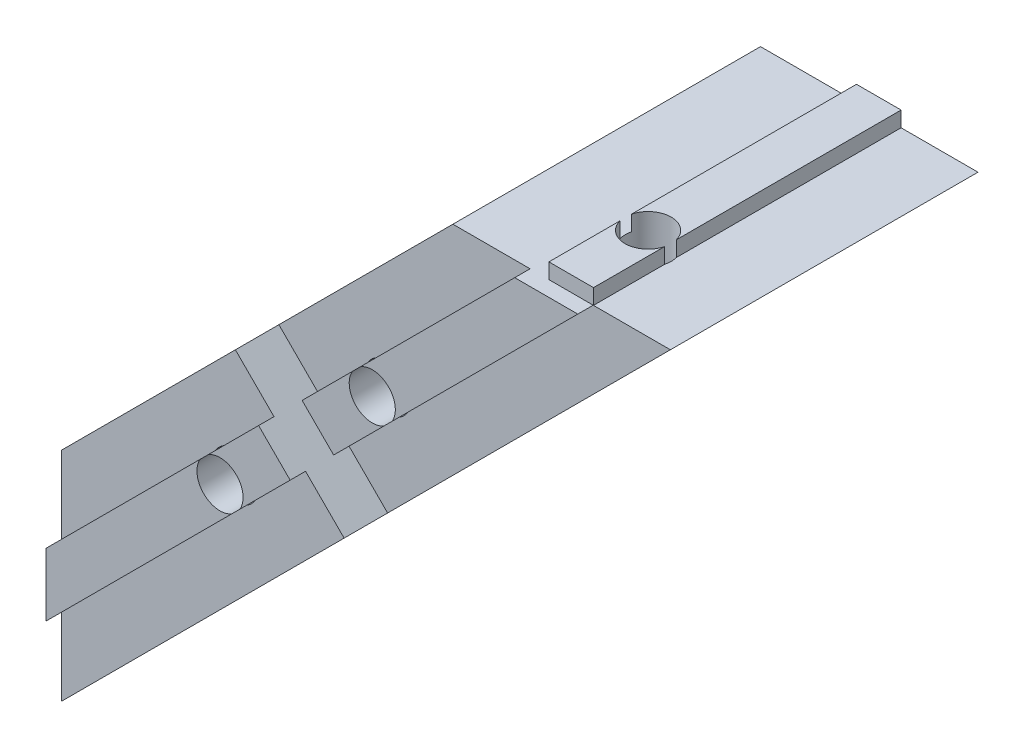
from build123d import *

# Parameters (mm, degrees)
BOSS_EXTRU_1_DEPTH       = 20
ESQUISSE2_W              = 10
ESQUISSE2_H              = 21
ENL_V_MAT_EXTRU_1_DEPTH  = 2.5
ESQUISSE3_R              = 1.5
ENL_V_MAT_EXTRU_2_DEPTH  = 38.732870983
ESQUISSE4_R              = 4.1
ENL_V_MAT_EXTRU_3_DEPTH  = 36.842591175
ESQUISSE5_R              = 1.25
ENL_V_MAT_EXTRU_4_DEPTH  = 37.976343789
BOSS_EXTRU_2_DEPTH       = 1
ENL_V_MAT_EXTRU_7_DEPTH  = 34.271609519
ENL_V_MAT_EXTRU_8_DEPTH  = 34.271609519
ESQUISSE11_R             = 1.5
ENL_V_MAT_EXTRU_9_DEPTH  = 34.271609519
ESQUISSE12_R             = 4.1
ENL_V_MAT_EXTRU_10_DEPTH = 7.5


with BuildPart() as part:
    # Esquisse1 → Boss.-Extru.1 (new body)
    with BuildSketch(Plane.XY):
        Polygon((0, 0), (0, 5), (-1, 5), (-1, 7.9), (0, 7.9), (0, 14.142135624), (11.313708499, 25.455844123), (18.384776311, 18.384776311), align=None)
    extrude(amount=BOSS_EXTRU_1_DEPTH)

    # Esquisse2 → Enlèv. mat.-Extru.1 (cut)
    with BuildSketch(Plane(origin=(0, 0, 0), x_dir=(0, 0, -1), z_dir=(0.7071067811865512, -0.7071067811865438, 0))):
        with Locations((-5, 15.5)):
            Rectangle(ESQUISSE2_W, ESQUISSE2_H)
    extrude(amount=-ENL_V_MAT_EXTRU_1_DEPTH, mode=Mode.SUBTRACT)

    # Esquisse3 → Enlèv. mat.-Extru.2 (cut, through all)
    with BuildSketch(Plane.ZY.offset(1)):
        with Locations((15, 6.45)):
            Circle(ESQUISSE3_R)
    extrude(amount=-ENL_V_MAT_EXTRU_2_DEPTH, mode=Mode.SUBTRACT)

    # Esquisse4 → Enlèv. mat.-Extru.3 (cut, through all)
    with BuildSketch(Plane.ZY.offset(-3)):
        with Locations((15, 6.45)):
            Circle(ESQUISSE4_R)
    extrude(amount=-ENL_V_MAT_EXTRU_3_DEPTH, mode=Mode.SUBTRACT)

    # Esquisse5 → Enlèv. mat.-Extru.4 (cut, through all)
    with BuildSketch(Plane(origin=(-1.767766953, 1.767766953, 0), x_dir=(0, 0, -1), z_dir=(0.7071067811865513, -0.7071067811865438, 0))):
        with Locations((-5, 11.5)):
            Circle(ESQUISSE5_R)
    extrude(amount=-ENL_V_MAT_EXTRU_4_DEPTH, mode=Mode.SUBTRACT)

    # Esquisse6 → Boss.-Extru.2 (add)
    with BuildSketch(Plane.XY.offset(20)):
        Polygon((0, 9.121677477), (13.823937572, 22.94561505), (15.874547238, 20.895005384), (0, 5.020458146), align=None)
    extrude(amount=BOSS_EXTRU_2_DEPTH)

    # Esquisse9 → Enlèv. mat.-Extru.7 (cut, through all)
    with BuildSketch(Plane(origin=(0, 0, 10), x_dir=(-1, 0, 0), z_dir=(0, 0, -1))):
        Polygon((-18.384776311, 18.384776311), (-12.02081528, 12.02081528), (-4.949747468, 19.091883092), (-11.313708499, 25.455844123), align=None)
    extrude(amount=ENL_V_MAT_EXTRU_7_DEPTH, mode=Mode.SUBTRACT)

    # Esquisse10 → Enlèv. mat.-Extru.8 (cut, through all)
    with BuildSketch(Plane(origin=(0, 0, 10), x_dir=(-1, 0, 0), z_dir=(0, 0, -1))):
        Polygon((-11.313708499, 25.455844123), (-4.242640687, 18.384776311), (-11.313708499, 11.313708499), (-18.384776311, 18.384776311), align=None)
    extrude(amount=ENL_V_MAT_EXTRU_8_DEPTH, mode=Mode.SUBTRACT)

    # Esquisse11 → Enlèv. mat.-Extru.9 (cut, through all)
    with BuildSketch(Plane(origin=(0, 0, 10), x_dir=(-1, 0, 0), z_dir=(0, 0, -1))):
        with Locations((-11.313708499, 18.384776311)):
            Circle(ESQUISSE11_R)
    extrude(amount=-ENL_V_MAT_EXTRU_9_DEPTH, mode=Mode.SUBTRACT)

    # Esquisse12 → Enlèv. mat.-Extru.10 (cut)
    with BuildSketch(Plane(origin=(0, 0, 10), x_dir=(-1, 0, 0), z_dir=(0, 0, -1))):
        with Locations((-11.313708499, 18.384776311)):
            Circle(ESQUISSE12_R)
    extrude(amount=-ENL_V_MAT_EXTRU_10_DEPTH, mode=Mode.SUBTRACT)


with BuildPart() as body_2:
    # Symétrie2: mirrored copy
    add(part.part.mirror(Plane(origin=(19.798989873, 19.798989873, 0), x_dir=(0, 0, 1), z_dir=(0.7071067811865434, 0.7071067811865517, 0))))


solid = Compound([part.part, body_2.part])
